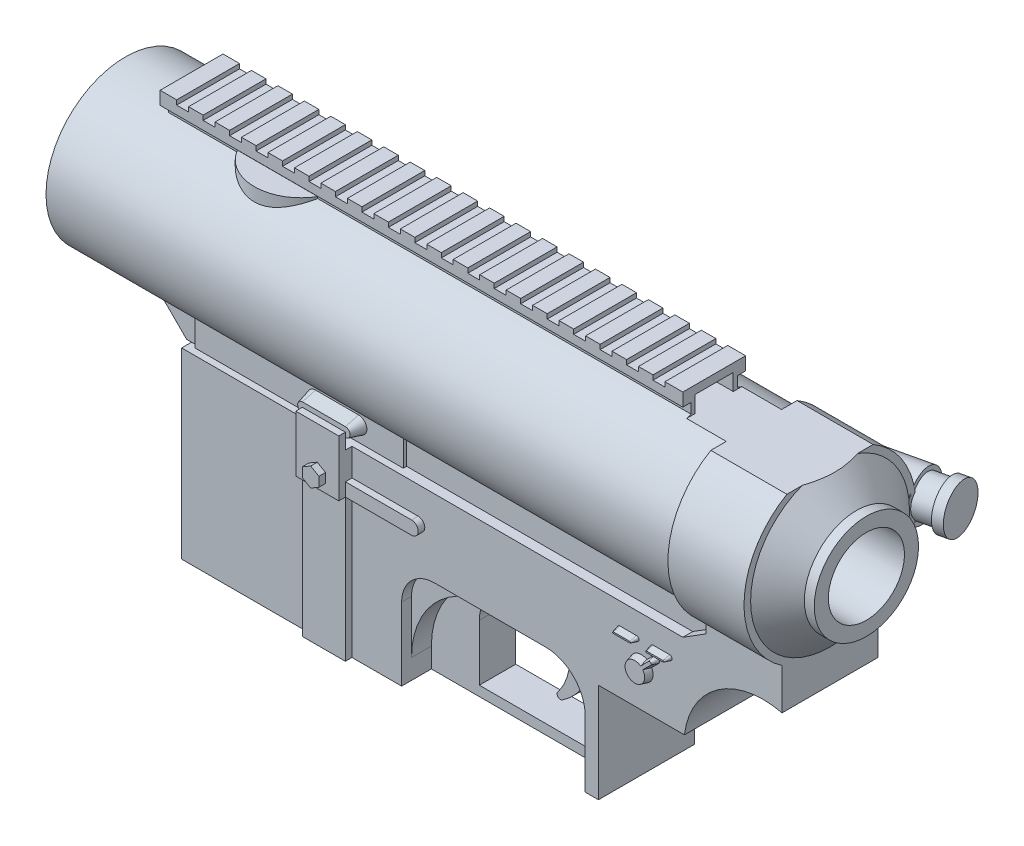
from build123d import *

# Parameters (mm, degrees)
EXTRUDE_START             = -46
EXTRUDE_1_DEPTH           = 158
EXTRUDE_2_DEPTH           = 14.5
CUT_EXTRUDE_1_DEPTH       = 3
CUT_EXTRUDE_2_DEPTH       = 6
CUT_EXTRUDE_3_DEPTH       = 242.218780363
EXTRUDE_3_DEPTH           = 2
EXTRUDE_START_2           = -11
SKETCH_9_R                = 26
EXTRUDE_4_DEPTH           = 23
CUT_EXTRUDE_4_DEPTH       = 3
SKETCH_11_W               = 13
SKETCH_11_H               = 55.3
EXTRUDE_5_DEPTH           = 2
SKETCH_14_W               = 63
SKETCH_14_H               = 84.5
EXTRUDE_6_DEPTH           = 1
EXTRUDE_7_DEPTH           = 2
EXTRUDE_7_DRAFT           = 15
EXTRUDE_8_DEPTH           = 2
EXTRUDE_8_DRAFT           = 15
EXTRUDE_8_PROFILE_2_DEPTH = 2
EXTRUDE_8_PROFILE_2_DRAFT = 15
EXTRUDE_9_DEPTH           = 4
EXTRUDE_9_TAPER           = 15
SKETCH_18_W               = 13
SKETCH_18_H               = 17
EXTRUDE_10_DEPTH          = 2
EXTRUDE_11_DEPTH          = 2
EXTRUDE_12_DEPTH          = 2
MIRROR_3_COPY_1_DEPTH     = 2
MIRROR_3_COPY_1_DRAFT     = 15
MIRROR_3_COPY_2_DEPTH     = 2
MIRROR_3_COPY_2_DRAFT     = 15
MIRROR_3_COPY_3_DEPTH     = 2
MIRROR_3_COPY_3_DRAFT     = 15
CUT_EXTRUDE_5_REACH       = 256.545
CUT_EXTRUDE_5_END_RADIUS  = 19.124591499
SKETCH_26_W               = 58
SKETCH_26_H               = 21
SKETCH_27_W               = 139
SKETCH_27_H               = 15.5
CUT_EXTRUDE_6_DEPTH       = 51.5
CUT_EXTRUDE_START         = -2.5
SKETCH_28_W               = 42
SKETCH_28_H               = 11.5
CUT_EXTRUDE_8_DEPTH       = 5
SKETCH_29_W               = 26.057628442
SKETCH_29_H               = 7.5
CUT_EXTRUDE_9_DEPTH       = 46
SKETCH_30_W               = 3.6
SKETCH_30_H               = 1.4
CUT_EXTRUDE_10_DEPTH      = 245.235807084
EXTRUDE_START_3           = -10.506411
SKETCH_31_R               = 14
EXTRUDE_15_DEPTH          = 4.006411
CUT_EXTRUDE_START_2       = -5.75
CUT_EXTRUDE_11_OUTLINE_W  = 112
CUT_EXTRUDE_11_OUTLINE_H  = 10.5
CUT_EXTRUDE_11_DEPTH      = 11.5


# Read off the part's stored shape, not the designer's step: 切除-拉伸11
with BuildPart() as part:
    # 草图1 → 旋转1 (revolve)
    with BuildSketch(Plane.XY, mode=Mode.PRIVATE) as revolve_1_sk:
        Polygon((224, 0), (224, 15.75), (221, 15.75), (213, 24), (0, 24), (0, 0), align=None)
    revolve(revolve_1_sk.sketch.rotate(Axis((0, 0, 0), (1, 0, 0)), 90), axis=Axis((0, 0, 0), (1, 0, 0)))

    # 草图2 → 凸台-拉伸1 (add)
    with BuildSketch(Plane(origin=(224, 0, 0), x_dir=(0, 0, -1), z_dir=(1, 0, 0)).offset(EXTRUDE_START)):
        Polygon((-7, 26.04), (-7, 0), (7, 0), (7, 26.04), (9.5, 26.04), (9.5, 30), (-9.5, 30), (-9.5, 26.04), align=None)
    extrude(amount=-EXTRUDE_1_DEPTH)



with BuildPart() as body_2:
    # 草图3 → 凸台-拉伸2 (new, symmetric)
    with BuildSketch(Plane.XY):
        with BuildLine():
            Line((213, -24), (213, -34))
            ThreePointArc((213, -34), (193.637814777, -37.612952972), (183.5, -54.5))
            Line((183.5, -54.5), (157.5, -54.5))
            Line((157.5, -54.5), (157.5, -84.5))
            Line((157.5, -84.5), (31.5, -84.5))
            Line((31.5, -84.5), (31.5, -29.2))
            Line((31.5, -29.2), (30, -29.2))
            Line((30, -29.2), (24.8, -24))
            Line((24.8, -24), (0, 0))
            Line((0, 0), (213, 0))
            Line((213, 0), (213, -24))
        make_face()
    extrude(amount=EXTRUDE_2_DEPTH, both=True)

    # 草图4 → 切除-拉伸1 (cut)
    with BuildSketch(Plane.XY.offset(14.5)):
        with BuildLine():
            Line((98, -84.5), (98, -62.5))
            ThreePointArc((98, -62.5), (100.928932188, -55.428932188), (108, -52.5))
            Line((108, -52.5), (141.5, -52.5))
            ThreePointArc((141.5, -52.5), (149.985281374, -56.014718626), (153.5, -64.5))
            Line((153.5, -64.5), (153.5, -84.5))
            Line((153.5, -84.5), (98, -84.5))
        make_face()
    cut_extrude_1 = extrude(amount=-CUT_EXTRUDE_1_DEPTH, mode=Mode.SUBTRACT)

    # 草图6 → 切除-拉伸2 (cut)
    with BuildSketch(Plane.XY.offset(11.5)):
        with BuildLine():
            Line((98, -84.5), (98, -78.5))
            ThreePointArc((98, -78.5), (105.615223689, -60.115223689), (124, -52.5))
            Line((124, -52.5), (141.5, -52.5))
            ThreePointArc((141.5, -52.5), (149.985281374, -56.014718626), (153.5, -64.5))
            Line((153.5, -64.5), (153.5, -84.5))
            Line((153.5, -84.5), (98, -84.5))
        make_face()
    cut_extrude_2 = extrude(amount=-CUT_EXTRUDE_2_DEPTH, mode=Mode.SUBTRACT)

    # 镜向1: 切除-拉伸1, 切除-拉伸2 across plane
    add(cut_extrude_1.mirror(Plane.XY), mode=Mode.SUBTRACT)
    add(cut_extrude_2.mirror(Plane.XY), mode=Mode.SUBTRACT)

    # 草图7 → 切除-拉伸3 (cut, through all)
    with BuildSketch(Plane.XY.offset(5.5)):
        with BuildLine():
            Line((112.5, -64.5), (112.5, -81.5))
            Line((112.5, -81.5), (153.5, -81.5))
            Line((153.5, -81.5), (153.5, -64.5))
            ThreePointArc((153.5, -64.5), (149.985281374, -56.014718626), (141.5, -52.5))
            Line((141.5, -52.5), (124.5, -52.5))
            ThreePointArc((124.5, -52.5), (116.014718626, -56.014718626), (112.5, -64.5))
        make_face()
    extrude(amount=-CUT_EXTRUDE_3_DEPTH, mode=Mode.SUBTRACT)

    # 草图8 → 凸台-拉伸3 (add, symmetric)
    with BuildSketch(Plane.XY):
        with BuildLine():
            Line((141.5, -52.5), (131.5, -52.5))
            ThreePointArc((131.5, -52.5), (136.318202158, -63.462867914), (132.71350738, -74.882400324))
            ThreePointArc((132.71350738, -74.882400324), (132.764843993, -76.177897961), (134.051940782, -76.333883309))
            ThreePointArc((134.051940782, -76.333883309), (142.25067619, -65.849140581), (142.5, -52.541739257))
            ThreePointArc((142.5, -52.541739257), (142.000435352, -52.510439355), (141.5, -52.5))
        make_face()
    extrude(amount=EXTRUDE_3_DEPTH, both=True)


with BuildPart() as part_1:
    add(part.part)

    add(body_2.part)  # 凸台-拉伸4 merges body 2
    # 草图9 → 凸台-拉伸4 (add)
    with BuildSketch(Plane(origin=(224, 0, 0), x_dir=(0, 0, -1), z_dir=(1, 0, 0)).offset(EXTRUDE_START_2)):
        Circle(SKETCH_9_R)
    extrude(amount=-EXTRUDE_4_DEPTH)

    # 草图10 → 切除-拉伸4 (cut)
    with BuildSketch(Plane.XY.offset(14.5)):
        Polygon((24.8, -24), (30, -29.2), (31.5, -29.2), (183, -29.2), (190, -24.825914537), (190, -21.581241855), (190, -19.124591499), (19.762077882, -19.124591499), align=None)
    cut_extrude_4 = extrude(amount=-CUT_EXTRUDE_4_DEPTH, mode=Mode.SUBTRACT)

    # 草图11 → 凸台-拉伸5 (add)
    with BuildSketch(Plane.XY.offset(14.5)):
        with Locations((76.5, -56.85)):
            Rectangle(SKETCH_11_W, SKETCH_11_H)
    extrude_5 = extrude(amount=EXTRUDE_5_DEPTH)

    # 草图14 → 凸台-拉伸6 (add)
    with BuildSketch(Plane.XY.offset(11.5)):
        with Locations((65, -42.25)):
            Rectangle(SKETCH_14_W, SKETCH_14_H)
    extrude_6 = extrude(amount=EXTRUDE_6_DEPTH)

    # 镜向2: 切除-拉伸4, 凸台-拉伸5, 凸台-拉伸6 across plane
    add(cut_extrude_4.mirror(Plane.XY), mode=Mode.SUBTRACT)
    add(extrude_5.mirror(Plane.XY))
    add(extrude_6.mirror(Plane.XY))


with BuildPart() as extrude_7_tool:
    # 草图15 → 凸台-拉伸7 (with draft: the straight prism first)
    with BuildSketch(Plane.XY.offset(14.5)):
        with BuildLine():
            ThreePointArc((172.164601464, -40.421184974), (168.025126266, -45.974873734), (173.578815026, -41.835398536))
            Line((173.578815026, -41.835398536), (175.707106781, -39.707106781))
            ThreePointArc((175.707106781, -39.707106781), (175.707106781, -38.292893219), (174.292893219, -38.292893219))
            Line((174.292893219, -38.292893219), (172.164601464, -40.421184974))
        make_face()
    extrude(amount=EXTRUDE_7_DEPTH)
    # 凸台-拉伸7: the draft: its side faces are tilted about the plane it starts from
    extrude_7_sides = [extrude_7_tool.faces().sort_by_distance(p)[0] for p in [
        (168.025126266, -45.974873734, 15.5),
        (174.642960904, -40.771252659, 15.5),
        (175.707106781, -38.292893219, 15.5),
        (173.228747341, -39.357039096, 15.5),
    ]]
    draft(extrude_7_sides, Plane.XY.offset(14.5), EXTRUDE_7_DRAFT)


with BuildPart() as part_2:
    add(part_1.part)

    # 凸台-拉伸7: add extrude_7_tool
    add(extrude_7_tool.part)


with BuildPart() as extrude_8_tool:
    # 草图16 → 凸台-拉伸8 (with draft: the straight prism first)
    with BuildSketch(Plane.XY.offset(14.5)):
        with BuildLine():
            ThreePointArc((164, -35.75), (163.25, -36.5), (164, -37.25))
            Line((164, -37.25), (169, -37.25))
            ThreePointArc((169, -37.25), (169.75, -36.5), (169, -35.75))
            Line((169, -35.75), (164, -35.75))
        make_face()
    extrude(amount=EXTRUDE_8_DEPTH)
    # 凸台-拉伸8: the draft: its side faces are tilted about the plane it starts from
    extrude_8_sides = [extrude_8_tool.faces().sort_by_distance(p)[0] for p in [
        (163.25, -36.5, 15.5),
        (166.5, -37.25, 15.5),
        (169.75, -36.5, 15.5),
        (166.5, -35.75, 15.5),
    ]]
    draft(extrude_8_sides, Plane.XY.offset(14.5), EXTRUDE_8_DRAFT)


with BuildPart() as part_3:
    add(part_2.part)

    # 凸台-拉伸8: add extrude_8_tool
    add(extrude_8_tool.part)


with BuildPart() as extrude_8_profile_2_tool:
    # 草图16 → 凸台-拉伸8 profile 2 (with draft: the straight prism first)
    with BuildSketch(Plane.XY.offset(14.5)):
        with BuildLine():
            ThreePointArc((174, -35.75), (173.25, -36.5), (174, -37.25))
            Line((174, -37.25), (179, -37.25))
            ThreePointArc((179, -37.25), (179.75, -36.5), (179, -35.75))
            Line((179, -35.75), (174, -35.75))
        make_face()
    extrude(amount=EXTRUDE_8_PROFILE_2_DEPTH)
    # 凸台-拉伸8 profile 2: the draft: its side faces are tilted about the plane it starts from
    extrude_8_profile_2_sides = [extrude_8_profile_2_tool.faces().sort_by_distance(p)[0] for p in [
        (173.25, -36.5, 15.5),
        (176.5, -37.25, 15.5),
        (179.75, -36.5, 15.5),
        (176.5, -35.75, 15.5),
    ]]
    draft(extrude_8_profile_2_sides, Plane.XY.offset(14.5), EXTRUDE_8_PROFILE_2_DRAFT)


with BuildPart() as part_4:
    add(part_3.part)

    # 凸台-拉伸8 profile 2: add extrude_8_profile_2_tool
    add(extrude_8_profile_2_tool.part)

    # 草图17 → 凸台-拉伸9 (add)
    with BuildSketch(Plane.XY.offset(12.5)):
        with BuildLine():
            ThreePointArc((70, -22), (67.5, -24.5), (70, -27))
            Line((70, -27), (83, -27))
            ThreePointArc((83, -27), (85.5, -24.5), (83, -22))
            Line((83, -22), (70, -22))
        make_face()
    extrude_9 = extrude(amount=EXTRUDE_9_DEPTH, taper=EXTRUDE_9_TAPER)

    # 草图18 → 凸台-拉伸10 (add)
    with BuildSketch(Plane.XY.offset(16.5)):
        with Locations((76.5, -33)):
            Rectangle(SKETCH_18_W, SKETCH_18_H)
    extrude(amount=EXTRUDE_10_DEPTH)

    # 草图19 → 凸台-拉伸11 (add)
    with BuildSketch(Plane.XY.offset(14.5)):
        with BuildLine():
            Line((83, -37.5), (103, -37.5))
            ThreePointArc((103, -37.5), (105, -39.5), (103, -41.5))
            Line((103, -41.5), (83, -41.5))
            ThreePointArc((83, -41.5), (81, -39.5), (83, -37.5))
        make_face()
    extrude(amount=EXTRUDE_11_DEPTH)

    # 草图21 → 凸台-拉伸12 (add)
    with BuildSketch(Plane.XY.offset(18.5)):
        Polygon((79, -36.056624327), (76.5, -34.613248654), (74, -36.056624327), (74, -38.943375673), (76.5, -40.386751346), (79, -38.943375673), align=None)
    extrude(amount=EXTRUDE_12_DEPTH)

    # 镜向3: 凸台-拉伸9 across plane
    add(extrude_9.mirror(Plane.XY))


with BuildPart() as mirror_3_copy_1_tool:
    # 镜向3 copy 1 sketch → 镜向3 copy 1 (with draft: the straight prism first)
    with BuildSketch(Plane(origin=(0, 0, -14.5), x_dir=(1, 0, 0), z_dir=(0, 0, -1))):
        with BuildLine():
            ThreePointArc((164, 35.75), (163.25, 36.5), (164, 37.25))
            Line((164, 37.25), (169, 37.25))
            ThreePointArc((169, 37.25), (169.75, 36.5), (169, 35.75))
            Line((169, 35.75), (164, 35.75))
        make_face()
    extrude(amount=MIRROR_3_COPY_1_DEPTH)
    # 镜向3 copy 1: the draft: its side faces are tilted about the plane it starts from
    mirror_3_copy_1_sides = [mirror_3_copy_1_tool.faces().sort_by_distance(p)[0] for p in [
        (163.25, -36.5, -15.5),
        (166.5, -37.25, -15.5),
        (169.75, -36.5, -15.5),
        (166.5, -35.75, -15.5),
    ]]
    draft(mirror_3_copy_1_sides, Plane(origin=(0, 0, -14.5), x_dir=(1, 0, 0), z_dir=(0, 0, -1)), MIRROR_3_COPY_1_DRAFT)


with BuildPart() as part_5:
    add(part_4.part)

    # 镜向3 copy 1: add mirror_3_copy_1_tool
    add(mirror_3_copy_1_tool.part)


with BuildPart() as mirror_3_copy_2_tool:
    # 镜向3 copy 2 sketch → 镜向3 copy 2 (with draft: the straight prism first)
    with BuildSketch(Plane(origin=(0, 0, -14.5), x_dir=(1, 0, 0), z_dir=(0, 0, -1))):
        with BuildLine():
            ThreePointArc((174, 35.75), (173.25, 36.5), (174, 37.25))
            Line((174, 37.25), (179, 37.25))
            ThreePointArc((179, 37.25), (179.75, 36.5), (179, 35.75))
            Line((179, 35.75), (174, 35.75))
        make_face()
    extrude(amount=MIRROR_3_COPY_2_DEPTH)
    # 镜向3 copy 2: the draft: its side faces are tilted about the plane it starts from
    mirror_3_copy_2_sides = [mirror_3_copy_2_tool.faces().sort_by_distance(p)[0] for p in [
        (173.25, -36.5, -15.5),
        (176.5, -37.25, -15.5),
        (179.75, -36.5, -15.5),
        (176.5, -35.75, -15.5),
    ]]
    draft(mirror_3_copy_2_sides, Plane(origin=(0, 0, -14.5), x_dir=(1, 0, 0), z_dir=(0, 0, -1)), MIRROR_3_COPY_2_DRAFT)


with BuildPart() as part_6:
    add(part_5.part)

    # 镜向3 copy 2: add mirror_3_copy_2_tool
    add(mirror_3_copy_2_tool.part)


with BuildPart() as mirror_3_copy_3_tool:
    # 镜向3 copy 3 sketch → 镜向3 copy 3 (with draft: the straight prism first)
    with BuildSketch(Plane(origin=(0, 0, -14.5), x_dir=(1, 0, 0), z_dir=(0, 0, -1))):
        with BuildLine():
            ThreePointArc((174, 35.75), (173.25, 36.5), (174, 37.25))
            Line((174, 37.25), (179, 37.25))
            ThreePointArc((179, 37.25), (179.75, 36.5), (179, 35.75))
            Line((179, 35.75), (174, 35.75))
        make_face()
    extrude(amount=MIRROR_3_COPY_3_DEPTH)
    # 镜向3 copy 3: the draft: its side faces are tilted about the plane it starts from
    mirror_3_copy_3_sides = [mirror_3_copy_3_tool.faces().sort_by_distance(p)[0] for p in [
        (173.25, -36.5, -15.5),
        (176.5, -37.25, -15.5),
        (179.75, -36.5, -15.5),
        (176.5, -35.75, -15.5),
    ]]
    draft(mirror_3_copy_3_sides, Plane(origin=(0, 0, -14.5), x_dir=(1, 0, 0), z_dir=(0, 0, -1)), MIRROR_3_COPY_3_DRAFT)


with BuildPart() as part_7:
    add(part_6.part)

    # 镜向3 copy 3: add mirror_3_copy_3_tool
    add(mirror_3_copy_3_tool.part)

    # 草图24 → 旋转3 (revolve)
    with BuildSketch(Plane(origin=(0, 0, 0), x_dir=(1, 0, 0), z_dir=(0, 1, 0)), mode=Mode.PRIVATE) as revolve_3_sk:
        Polygon((220.5, 32), (218.92534262, 38.820590453), (216.002232425, 38.14573729), (216.283421243, 36.927774709), (210.437200854, 35.578068383), (210.156012037, 36.796030964), (80.318114643, 6.820590453), (81.892772023, 0), align=None)
    revolve(revolve_3_sk.sketch.rotate(Axis((81.892772023, 0, 0), (0.9743700647852351, 0, -0.22495105434386536)), 180), axis=Axis((81.892772023, 0, 0), (0.9743700647852351, 0, -0.22495105434386536)))

    # 草图25 → 切除-旋转2 (revolve, cut)
    with BuildSketch(Plane.XY, mode=Mode.PRIVATE) as cut_revolve_2_sk:
        Polygon((224, -11.5), (201, -11.5), (201, -19.124591499), (0, -19.124591499), (0, 0), (224, 0), align=None)
    revolve(cut_revolve_2_sk.sketch.rotate(Axis((0, 0, 0), (1, 0, 0)), 270), axis=Axis((0, 0, 0), (1, 0, 0)), mode=Mode.SUBTRACT)

    # 切除-拉伸5: up to this cylinder (the profile starts outside it)
    cut_extrude_5_end = Plane(origin=(65.5, 0, 0), z_dir=(-1, 0, 0)) * Cylinder(CUT_EXTRUDE_5_END_RADIUS, 552.339182998, mode=Mode.PRIVATE)
    # 草图26 → 切除-拉伸5 (cut, up to the surface)
    with BuildSketch(Plane.XZ.offset(84.5), mode=Mode.PRIVATE) as cut_extrude_5_sk1:
        with Locations((65.5, 0)):
            Rectangle(SKETCH_26_W, SKETCH_26_H)
    cut_extrude_5_tool1 = extrude(cut_extrude_5_sk1.sketch, amount=-CUT_EXTRUDE_5_REACH, mode=Mode.PRIVATE) - cut_extrude_5_end
    add(cut_extrude_5_tool1.solids().sort_by_distance((65.5, -84.5, 0))[0], mode=Mode.SUBTRACT)

    # 草图27 → 切除-拉伸6 (cut)
    with BuildSketch(Plane(origin=(0, 0, 0), x_dir=(1, 0, 0), z_dir=(0, 1, 0))):
        with Locations((106, 0)):
            Rectangle(SKETCH_27_W, SKETCH_27_H)
    extrude(amount=-CUT_EXTRUDE_6_DEPTH, mode=Mode.SUBTRACT)

    # 草图28 → 切除-拉伸8 (cut)
    with BuildSketch(Plane(origin=(0, 30, 0), x_dir=(1, 0, 0), z_dir=(0, 1, 0)).offset(CUT_EXTRUDE_START)):
        with Locations((157, 0)):
            Rectangle(SKETCH_28_W, SKETCH_28_H)
    extrude(amount=-CUT_EXTRUDE_8_DEPTH, mode=Mode.SUBTRACT)

    # 草图29 → 切除-拉伸9 (cut)
    with BuildSketch(Plane(origin=(224, 0, 0), x_dir=(0, 0, -1), z_dir=(1, 0, 0))):
        with Locations((0, 26.25)):
            Rectangle(SKETCH_29_W, SKETCH_29_H)
    extrude(amount=-CUT_EXTRUDE_9_DEPTH, mode=Mode.SUBTRACT)

    # 草图30 → 切除-拉伸10 (cut, through all)
    with BuildSketch(Plane.XY.offset(9.5)):
        with Locations((26.8, 29.3)):
            Rectangle(SKETCH_30_W, SKETCH_30_H)
        with Locations((34.8, 29.3)):
            Rectangle(SKETCH_30_W, SKETCH_30_H)
        with Locations((42.8, 29.3)):
            Rectangle(SKETCH_30_W, SKETCH_30_H)
        with Locations((50.8, 29.3)):
            Rectangle(SKETCH_30_W, SKETCH_30_H)
        with Locations((58.8, 29.3)):
            Rectangle(SKETCH_30_W, SKETCH_30_H)
        with Locations((66.8, 29.3)):
            Rectangle(SKETCH_30_W, SKETCH_30_H)
        with Locations((74.8, 29.3)):
            Rectangle(SKETCH_30_W, SKETCH_30_H)
        with Locations((82.8, 29.3)):
            Rectangle(SKETCH_30_W, SKETCH_30_H)
        with Locations((90.8, 29.3)):
            Rectangle(SKETCH_30_W, SKETCH_30_H)
        with Locations((98.8, 29.3)):
            Rectangle(SKETCH_30_W, SKETCH_30_H)
        with Locations((106.8, 29.3)):
            Rectangle(SKETCH_30_W, SKETCH_30_H)
        with Locations((114.8, 29.3)):
            Rectangle(SKETCH_30_W, SKETCH_30_H)
        with Locations((122.8, 29.3)):
            Rectangle(SKETCH_30_W, SKETCH_30_H)
        with Locations((130.8, 29.3)):
            Rectangle(SKETCH_30_W, SKETCH_30_H)
        with Locations((138.8, 29.3)):
            Rectangle(SKETCH_30_W, SKETCH_30_H)
        with Locations((146.8, 29.3)):
            Rectangle(SKETCH_30_W, SKETCH_30_H)
        with Locations((154.8, 29.3)):
            Rectangle(SKETCH_30_W, SKETCH_30_H)
        with Locations((162.8, 29.3)):
            Rectangle(SKETCH_30_W, SKETCH_30_H)
        with Locations((170.8, 29.3)):
            Rectangle(SKETCH_30_W, SKETCH_30_H)
    extrude(amount=-CUT_EXTRUDE_10_DEPTH, mode=Mode.SUBTRACT)

    # 草图31 → 凸台-拉伸15 (add)
    with BuildSketch(Plane(origin=(0, 30, 0), x_dir=(1, 0, 0), z_dir=(0, 1, 0)).offset(EXTRUDE_START_3)):
        with Locations((53, 0)):
            Circle(SKETCH_31_R)
    extrude(amount=EXTRUDE_15_DEPTH)

    # 切除-拉伸11 outline → 切除-拉伸11 (cut)
    with BuildSketch(Plane.XY.offset(CUT_EXTRUDE_START_2)):
        with Locations((80, 22.25)):
            Rectangle(CUT_EXTRUDE_11_OUTLINE_W, CUT_EXTRUDE_11_OUTLINE_H)
    extrude(amount=CUT_EXTRUDE_11_DEPTH, mode=Mode.SUBTRACT)


solid = part_7.part
